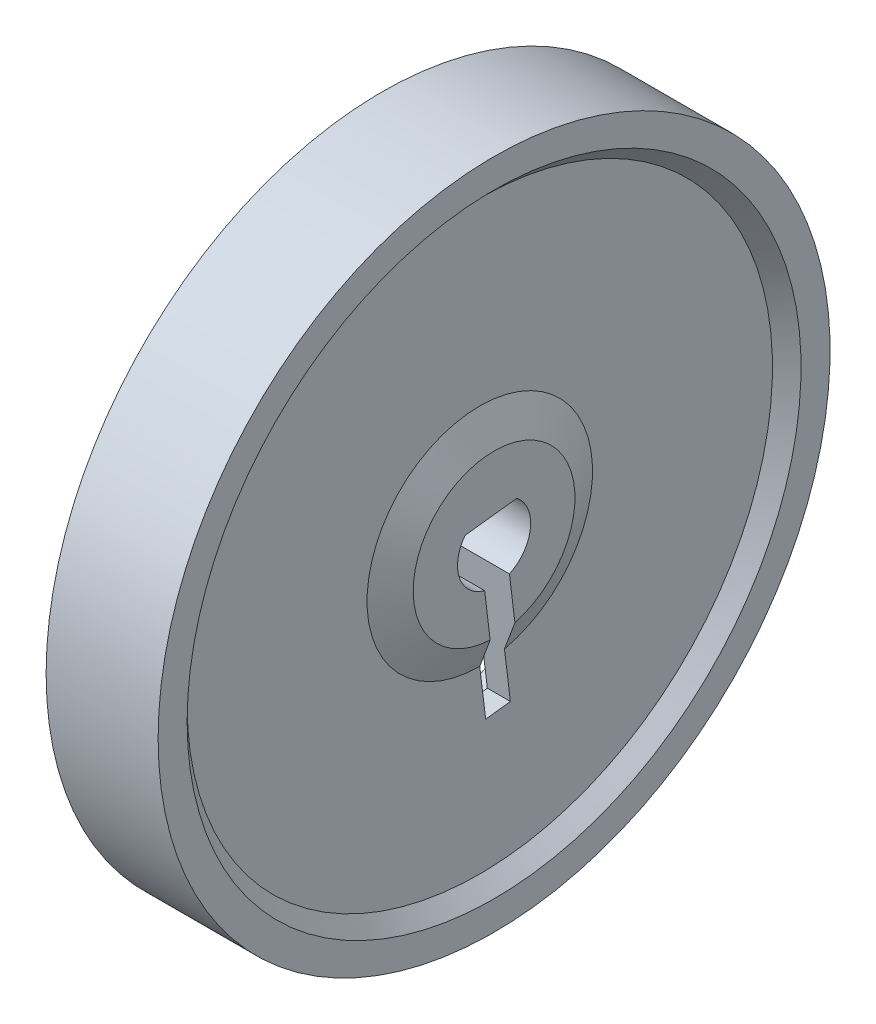
from build123d import *

# Parameters (mm, degrees)
CORTAR_EXTRUIR1_DEPTH = 10


with BuildPart() as part:
    # Croquis1 → Revolución2 (revolve)
    with BuildSketch(Plane.XY):
        Polygon((0, 12.334092632), (0, 13.5), (-4.5, 13.5), (-4.5, 9.583549686), (-1.5, 9.583549686), (-1.5, 3.25), (-7, 3.25), (-7, 0), (0, 0), (0, 3.25), (-0.574918787, 4.530302725), (-0.574918787, 11.759173845), align=None)
    revolve(axis=Axis((-7, 0, 0), (1, 0, 0)))

    # Croquis2 → Cortar-Extruir1 (cut)
    with BuildSketch(Plane(origin=(0, 0, 0), x_dir=(0, 0, -1), z_dir=(1, 0, 0))):
        with BuildLine():
            Line((0.916823697, 1.149058009), (0.524737182, 1.101385895))
            Line((0.524737182, 1.101385895), (-0.77337267, 0.943554298))
            Line((-0.77337267, 0.943554298), (-1.165459185, 0.895882184))
            ThreePointArc((-1.165459185, 0.895882184), (-1.392146699, -0.472046151), (-0.380201076, -1.419981388))
            Line((-0.380201076, -1.419981388), (0.236111814, -6.488940003))
            Line((0.236111814, -6.488940003), (1.228801228, -6.368243164))
            Line((1.228801228, -6.368243164), (0.616752973, -1.334359685))
            ThreePointArc((0.616752973, -1.334359685), (1.459385217, -0.176337142), (0.916823697, 1.149058009))
        make_face()
    extrude(amount=-CORTAR_EXTRUIR1_DEPTH, mode=Mode.SUBTRACT)


solid = part.part
